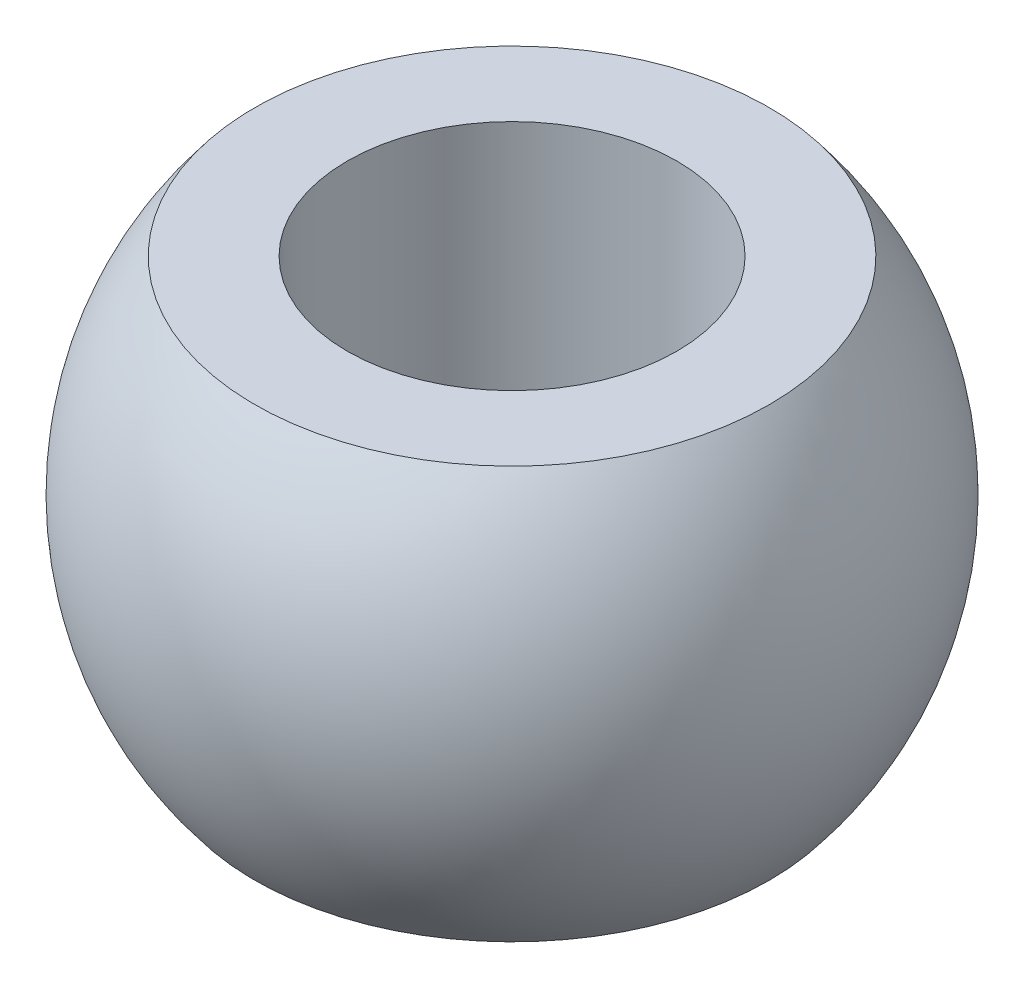
from build123d import *

# Parameters (mm, degrees)
CUT_EXTRUDE1_START     = -6.244997998
CUT_EXTRUDE1_OUTLINE_W = 16
CUT_EXTRUDE1_OUTLINE_H = 4
CUT_EXTRUDE1_DEPTH     = 12.489995996
CUT_EXTRUDE2_REACH     = 17.1
SKETCH3_R              = 4


# Read off the part's stored shape, not the designer's step: Cut-Extrude1
with BuildPart() as part:
    # Sketch1 → Revolve1 (revolve)
    with BuildSketch(Plane.XY):
        with BuildLine():
            Line((0, 8), (0, -8))
            ThreePointArc((0, -8), (-8, 0), (0, 8))
        make_face()
    revolve(axis=Axis((0, 8, 0), (0, -1, 0)))

    # Cut-Extrude1 outline → Cut-Extrude1 (cut)
    with BuildSketch(Plane.XY.offset(CUT_EXTRUDE1_START)):
        with Locations((0, -7)):
            Rectangle(CUT_EXTRUDE1_OUTLINE_W, CUT_EXTRUDE1_OUTLINE_H)
        with Locations((0, 7)):
            Rectangle(CUT_EXTRUDE1_OUTLINE_W, CUT_EXTRUDE1_OUTLINE_H)
    extrude(amount=CUT_EXTRUDE1_DEPTH, mode=Mode.SUBTRACT)

    # Sketch3 → Cut-Extrude2 (cut, up to next)
    with BuildSketch(Plane(origin=(0, 5, 0), x_dir=(1, 0, 0), z_dir=(0, 1, 0)), mode=Mode.PRIVATE) as cut_extrude2_sk1:
        with Locations(Location((0, 0, 0), (0, 0, 270))):
            Circle(SKETCH3_R)
    cut_extrude2_tool1 = extrude(cut_extrude2_sk1.sketch, amount=-CUT_EXTRUDE2_REACH, mode=Mode.PRIVATE) & part.part
    add(cut_extrude2_tool1.solids().sort_by_distance((0, 5, 0))[0], mode=Mode.SUBTRACT)


solid = part.part
